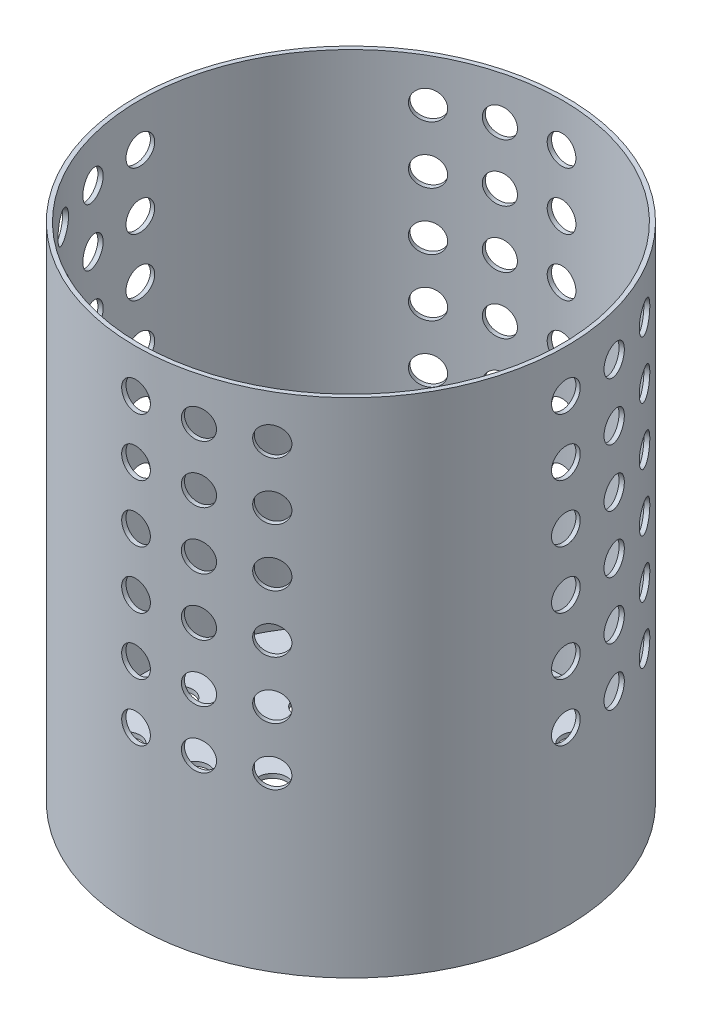
from build123d import *

# Parameters (mm, degrees)
SKETCH1_R                   = 75
BOSS_EXTRUDE1_DEPTH         = 175
SHELL2_T                    = -1.5
SKETCH2_R                   = 5
SKETCH2_R_2                 = 4.978999519
CUT_EXTRUDE1_DEPTH          = 175
SKETCH3_R                   = 5
CUT_EXTRUDE2_DEPTH          = 35
CIRPATTERN1_COUNT           = 3
CIRPATTERN1_ANGLE           = 30
CIRPATTERN2_COPY_1_SKETCH_R = 5
CIRPATTERN2_COPY_1_DEPTH    = 35
CIRPATTERN2_COPY_2_SKETCH_R = 5
CIRPATTERN2_COPY_2_DEPTH    = 35
CIRPATTERN2_COPY_3_SKETCH_R = 5
CIRPATTERN2_COPY_3_DEPTH    = 35
CIRPATTERN2_COPY_4_SKETCH_R = 5
CIRPATTERN2_COPY_4_DEPTH    = 35
CIRPATTERN2_COPY_5_SKETCH_R = 5
CIRPATTERN2_COPY_5_DEPTH    = 35
CIRPATTERN2_COPY_6_SKETCH_R = 5
CIRPATTERN2_COPY_6_DEPTH    = 35
CIRPATTERN2_COPY_7_SKETCH_R = 5
CIRPATTERN2_COPY_7_DEPTH    = 35
CIRPATTERN2_COPY_8_SKETCH_R = 5
CIRPATTERN2_COPY_8_DEPTH    = 35
CIRPATTERN2_COPY_9_SKETCH_R = 5
CIRPATTERN2_COPY_9_DEPTH    = 35


with BuildPart() as part:
    # Sketch1 → Boss-Extrude1 (new body)
    with BuildSketch(Plane(origin=(0, 0, 0), x_dir=(1, 0, 0), z_dir=(0, 1, 0))):
        Circle(SKETCH1_R)
    extrude(amount=BOSS_EXTRUDE1_DEPTH)

    # Shell2
    shell2_openings = [part.faces().sort_by_distance(p)[0] for p in [
        (0, 175, 0),
    ]]
    offset(amount=SHELL2_T, openings=shell2_openings, kind=Kind.INTERSECTION)

    # Sketch2 → Cut-Extrude1 (cut)
    with BuildSketch(Plane.XZ):
        Circle(SKETCH2_R)
        with Locations((0, 20)):
            Circle(SKETCH2_R_2)
        with Locations((0, 40)):
            Circle(SKETCH2_R_2)
        with Locations((0, 60)):
            Circle(SKETCH2_R_2)
        with Locations((17.320508076, 10)):
            Circle(SKETCH2_R_2)
        with Locations((17.320508076, -10)):
            Circle(SKETCH2_R_2)
        with Locations((0, -20)):
            Circle(SKETCH2_R_2)
        with Locations((-17.320508076, -10)):
            Circle(SKETCH2_R_2)
        with Locations((-17.320508076, 10)):
            Circle(SKETCH2_R_2)
        with Locations((20, 34.641016151)):
            Circle(SKETCH2_R_2)
        with Locations((34.641016151, 20)):
            Circle(SKETCH2_R_2)
        with Locations((40, 0)):
            Circle(SKETCH2_R_2)
        with Locations((34.641016151, -20)):
            Circle(SKETCH2_R_2)
        with Locations((20, -34.641016151)):
            Circle(SKETCH2_R_2)
        with Locations((0, -40)):
            Circle(SKETCH2_R_2)
        with Locations((-20, -34.641016151)):
            Circle(SKETCH2_R_2)
        with Locations((-34.641016151, -20)):
            Circle(SKETCH2_R_2)
        with Locations((-40, 0)):
            Circle(SKETCH2_R_2)
        with Locations((-34.641016151, 20)):
            Circle(SKETCH2_R_2)
        with Locations((-20, 34.641016151)):
            Circle(SKETCH2_R_2)
        with Locations((22.961005942, 55.432771951)):
            Circle(SKETCH2_R_2)
        with Locations((42.426406871, 42.426406871)):
            Circle(SKETCH2_R_2)
        with Locations((55.432771951, 22.961005942)):
            Circle(SKETCH2_R_2)
        with Locations((60, 0)):
            Circle(SKETCH2_R_2)
        with Locations((55.432771951, -22.961005942)):
            Circle(SKETCH2_R_2)
        with Locations((42.426406871, -42.426406871)):
            Circle(SKETCH2_R_2)
        with Locations((22.961005942, -55.432771951)):
            Circle(SKETCH2_R_2)
        with Locations((0, -60)):
            Circle(SKETCH2_R_2)
        with Locations((-22.961005942, -55.432771951)):
            Circle(SKETCH2_R_2)
        with Locations((-42.426406871, -42.426406871)):
            Circle(SKETCH2_R_2)
        with Locations((-55.432771951, -22.961005942)):
            Circle(SKETCH2_R_2)
        with Locations((-60, 0)):
            Circle(SKETCH2_R_2)
        with Locations((-55.432771951, 22.961005942)):
            Circle(SKETCH2_R_2)
        with Locations((-42.426406871, 42.426406871)):
            Circle(SKETCH2_R_2)
        with Locations((-22.961005942, 55.432771951)):
            Circle(SKETCH2_R_2)
    extrude(amount=-CUT_EXTRUDE1_DEPTH, mode=Mode.SUBTRACT)

    # Sketch3 → Cut-Extrude2 (cut)
    with BuildSketch(Plane(origin=(75, 0, 0), x_dir=(0, 0, -1), z_dir=(1, 0, 0))):
        with Locations((0, 160)):
            Circle(SKETCH3_R)
        with Locations((0, 140)):
            Circle(SKETCH3_R)
        with Locations((0, 120)):
            Circle(SKETCH3_R)
        with Locations((0, 100)):
            Circle(SKETCH3_R)
        with Locations((0, 80)):
            Circle(SKETCH3_R)
        with Locations((0, 60)):
            Circle(SKETCH3_R)
    cut_extrude2 = extrude(amount=-CUT_EXTRUDE2_DEPTH, mode=Mode.SUBTRACT)

    # CirPattern1: Cut-Extrude2 ×3 about axis
    cirpattern1_axis = Axis((0, 175, 0), (0, 1, 0))
    for i in range(1, CIRPATTERN1_COUNT):
        add(cut_extrude2.rotate(cirpattern1_axis, i * CIRPATTERN1_ANGLE / (CIRPATTERN1_COUNT - 1)), mode=Mode.SUBTRACT)

    # CirPattern2 copy 1 sketch → CirPattern2 copy 1 (cut)
    with BuildSketch(Plane(origin=(-19.411428383, 0, -72.444436972), x_dir=(-0.9659258262890681, 0, 0.25881904510252135), z_dir=(-0.25881904510252135, 0, -0.9659258262890681))):
        with Locations((0, 160)):
            Circle(CIRPATTERN2_COPY_1_SKETCH_R)
        with Locations((0, 140)):
            Circle(CIRPATTERN2_COPY_1_SKETCH_R)
        with Locations((0, 120)):
            Circle(CIRPATTERN2_COPY_1_SKETCH_R)
        with Locations((0, 100)):
            Circle(CIRPATTERN2_COPY_1_SKETCH_R)
        with Locations((0, 80)):
            Circle(CIRPATTERN2_COPY_1_SKETCH_R)
        with Locations((0, 60)):
            Circle(CIRPATTERN2_COPY_1_SKETCH_R)
    extrude(amount=-CIRPATTERN2_COPY_1_DEPTH, mode=Mode.SUBTRACT)

    # CirPattern2 copy 2 sketch → CirPattern2 copy 2 (cut)
    with BuildSketch(Plane(origin=(-72.444436972, 0, 19.411428383), x_dir=(0.2588190451025213, 0, 0.9659258262890681), z_dir=(-0.9659258262890681, 0, 0.2588190451025213))):
        with Locations((0, 160)):
            Circle(CIRPATTERN2_COPY_2_SKETCH_R)
        with Locations((0, 140)):
            Circle(CIRPATTERN2_COPY_2_SKETCH_R)
        with Locations((0, 120)):
            Circle(CIRPATTERN2_COPY_2_SKETCH_R)
        with Locations((0, 100)):
            Circle(CIRPATTERN2_COPY_2_SKETCH_R)
        with Locations((0, 80)):
            Circle(CIRPATTERN2_COPY_2_SKETCH_R)
        with Locations((0, 60)):
            Circle(CIRPATTERN2_COPY_2_SKETCH_R)
    extrude(amount=-CIRPATTERN2_COPY_2_DEPTH, mode=Mode.SUBTRACT)

    # CirPattern2 copy 3 sketch → CirPattern2 copy 3 (cut)
    with BuildSketch(Plane(origin=(19.411428383, 0, 72.444436972), x_dir=(0.9659258262890681, 0, -0.25881904510252124), z_dir=(0.25881904510252124, 0, 0.9659258262890681))):
        with Locations((0, 160)):
            Circle(CIRPATTERN2_COPY_3_SKETCH_R)
        with Locations((0, 140)):
            Circle(CIRPATTERN2_COPY_3_SKETCH_R)
        with Locations((0, 120)):
            Circle(CIRPATTERN2_COPY_3_SKETCH_R)
        with Locations((0, 100)):
            Circle(CIRPATTERN2_COPY_3_SKETCH_R)
        with Locations((0, 80)):
            Circle(CIRPATTERN2_COPY_3_SKETCH_R)
        with Locations((0, 60)):
            Circle(CIRPATTERN2_COPY_3_SKETCH_R)
    extrude(amount=-CIRPATTERN2_COPY_3_DEPTH, mode=Mode.SUBTRACT)

    # CirPattern2 copy 4 sketch → CirPattern2 copy 4 (cut)
    with BuildSketch(Plane(origin=(-37.5, 0, -64.951905284), x_dir=(-0.866025403784438, 0, 0.5000000000000011), z_dir=(-0.5000000000000011, 0, -0.866025403784438))):
        with Locations((0, 160)):
            Circle(CIRPATTERN2_COPY_4_SKETCH_R)
        with Locations((0, 140)):
            Circle(CIRPATTERN2_COPY_4_SKETCH_R)
        with Locations((0, 120)):
            Circle(CIRPATTERN2_COPY_4_SKETCH_R)
        with Locations((0, 100)):
            Circle(CIRPATTERN2_COPY_4_SKETCH_R)
        with Locations((0, 80)):
            Circle(CIRPATTERN2_COPY_4_SKETCH_R)
        with Locations((0, 60)):
            Circle(CIRPATTERN2_COPY_4_SKETCH_R)
    extrude(amount=-CIRPATTERN2_COPY_4_DEPTH, mode=Mode.SUBTRACT)

    # CirPattern2 copy 5 sketch → CirPattern2 copy 5 (cut)
    with BuildSketch(Plane(origin=(-64.951905284, 0, 37.5), x_dir=(0.500000000000001, 0, 0.8660254037844382), z_dir=(-0.8660254037844382, 0, 0.500000000000001))):
        with Locations((0, 160)):
            Circle(CIRPATTERN2_COPY_5_SKETCH_R)
        with Locations((0, 140)):
            Circle(CIRPATTERN2_COPY_5_SKETCH_R)
        with Locations((0, 120)):
            Circle(CIRPATTERN2_COPY_5_SKETCH_R)
        with Locations((0, 100)):
            Circle(CIRPATTERN2_COPY_5_SKETCH_R)
        with Locations((0, 80)):
            Circle(CIRPATTERN2_COPY_5_SKETCH_R)
        with Locations((0, 60)):
            Circle(CIRPATTERN2_COPY_5_SKETCH_R)
    extrude(amount=-CIRPATTERN2_COPY_5_DEPTH, mode=Mode.SUBTRACT)

    # CirPattern2 copy 6 sketch → CirPattern2 copy 6 (cut)
    with BuildSketch(Plane(origin=(37.5, 0, 64.951905284), x_dir=(0.8660254037844382, 0, -0.500000000000001), z_dir=(0.500000000000001, 0, 0.8660254037844382))):
        with Locations((0, 160)):
            Circle(CIRPATTERN2_COPY_6_SKETCH_R)
        with Locations((0, 140)):
            Circle(CIRPATTERN2_COPY_6_SKETCH_R)
        with Locations((0, 120)):
            Circle(CIRPATTERN2_COPY_6_SKETCH_R)
        with Locations((0, 100)):
            Circle(CIRPATTERN2_COPY_6_SKETCH_R)
        with Locations((0, 80)):
            Circle(CIRPATTERN2_COPY_6_SKETCH_R)
        with Locations((0, 60)):
            Circle(CIRPATTERN2_COPY_6_SKETCH_R)
    extrude(amount=-CIRPATTERN2_COPY_6_DEPTH, mode=Mode.SUBTRACT)

    # CirPattern2 copy 7 sketch → CirPattern2 copy 7 (cut)
    with BuildSketch(Plane(origin=(0, 0, -75), x_dir=(-1, 0, 0), z_dir=(0, 0, -1))):
        with Locations((0, 160)):
            Circle(CIRPATTERN2_COPY_7_SKETCH_R)
        with Locations((0, 140)):
            Circle(CIRPATTERN2_COPY_7_SKETCH_R)
        with Locations((0, 120)):
            Circle(CIRPATTERN2_COPY_7_SKETCH_R)
        with Locations((0, 100)):
            Circle(CIRPATTERN2_COPY_7_SKETCH_R)
        with Locations((0, 80)):
            Circle(CIRPATTERN2_COPY_7_SKETCH_R)
        with Locations((0, 60)):
            Circle(CIRPATTERN2_COPY_7_SKETCH_R)
    extrude(amount=-CIRPATTERN2_COPY_7_DEPTH, mode=Mode.SUBTRACT)

    # CirPattern2 copy 8 sketch → CirPattern2 copy 8 (cut)
    with BuildSketch(Plane.ZY.offset(75)):
        with Locations((0, 160)):
            Circle(CIRPATTERN2_COPY_8_SKETCH_R)
        with Locations((0, 140)):
            Circle(CIRPATTERN2_COPY_8_SKETCH_R)
        with Locations((0, 120)):
            Circle(CIRPATTERN2_COPY_8_SKETCH_R)
        with Locations((0, 100)):
            Circle(CIRPATTERN2_COPY_8_SKETCH_R)
        with Locations((0, 80)):
            Circle(CIRPATTERN2_COPY_8_SKETCH_R)
        with Locations((0, 60)):
            Circle(CIRPATTERN2_COPY_8_SKETCH_R)
    extrude(amount=-CIRPATTERN2_COPY_8_DEPTH, mode=Mode.SUBTRACT)

    # CirPattern2 copy 9 sketch → CirPattern2 copy 9 (cut)
    with BuildSketch(Plane.XY.offset(75)):
        with Locations((0, 160)):
            Circle(CIRPATTERN2_COPY_9_SKETCH_R)
        with Locations((0, 140)):
            Circle(CIRPATTERN2_COPY_9_SKETCH_R)
        with Locations((0, 120)):
            Circle(CIRPATTERN2_COPY_9_SKETCH_R)
        with Locations((0, 100)):
            Circle(CIRPATTERN2_COPY_9_SKETCH_R)
        with Locations((0, 80)):
            Circle(CIRPATTERN2_COPY_9_SKETCH_R)
        with Locations((0, 60)):
            Circle(CIRPATTERN2_COPY_9_SKETCH_R)
    extrude(amount=-CIRPATTERN2_COPY_9_DEPTH, mode=Mode.SUBTRACT)


solid = part.part
